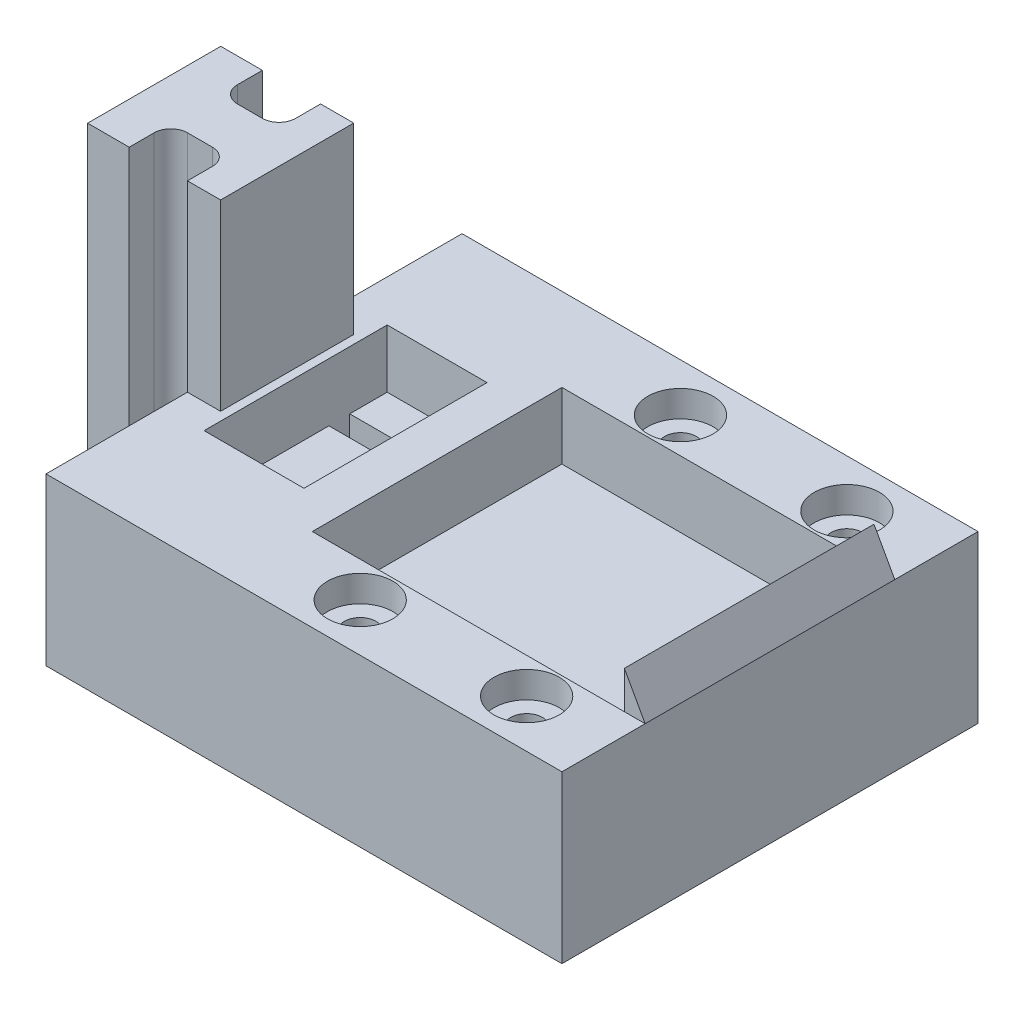
from build123d import *

# Parameters (mm, degrees)
SKETCH1_R               = 17.5
BOSS_EXTRUDE1_DEPTH     = 30
SKETCH5_R               = 10.95
CUT_EXTRUDE2_DEPTH      = 39.890873
SWEEP2_PITCH            = 10
SKETCH8_R               = 17.5
CUT_EXTRUDE3_DEPTH      = 41.699
SKETCH9_R               = 17.5
CUT_EXTRUDE4_DEPTH      = 39.890874
SKETCH10_W              = 40
SKETCH10_H              = 19.977262
BOSS_EXTRUDE2_DEPTH     = 40
SKETCH11_W              = 40
SKETCH11_H              = 19.977262
BOSS_EXTRUDE3_DEPTH     = 10
BOSS_EXTRUDE4_DEPTH     = 30
SKETCH14_R              = 1.905
CUT_EXTRUDE5_DEPTH      = 71.869594
SKETCH15_R              = 3.9243
CUT_EXTRUDE7_DEPTH      = 59.798031
SKETCH16_W              = 50
SKETCH16_H              = 19.977262
BOSS_EXTRUDE5_DEPTH     = 22
CUT_EXTRUDE8_DEPTH      = 12
BOSS_EXTRUDE6_DEPTH     = 19.977262
BOSS_EXTRUDE7_DEPTH     = 22
FILLET1_R               = 2
SKETCH21_W              = 7
SKETCH21_H              = 16
BOSS_EXTRUDE8_DEPTH     = 2
CUT_EXTRUDE9_DEPTH      = 76.769387
CUT_EXTRUDE9_DEPTH_BACK = 76.769387
SKETCH22_W              = 37.5
SKETCH22_H              = 30
SKETCH24_W              = 37.5
SKETCH24_H              = 30
BOSS_EXTRUDE9_DEPTH     = 12


with BuildPart() as part:
    # Sketch1 → Boss-Extrude1 (new body)
    with BuildSketch(Plane.XY):
        Circle(SKETCH1_R)
    extrude(amount=BOSS_EXTRUDE1_DEPTH)

    # Sketch5 → Cut-Extrude2 (cut, through all)
    with BuildSketch(Plane(origin=(0, 0, 0), x_dir=(-1, 0, 0), z_dir=(0, 0, -1))):
        Circle(SKETCH5_R)
    extrude(amount=-CUT_EXTRUDE2_DEPTH, mode=Mode.SUBTRACT)

    # Sweep2: arcs per turn and ends read off the stored shape
    # Sweep2: the profile of Sketch7 profile screwed along a right-hand helix through 3.75 turns, 16 arcs to a turn; built about Z, then put on its axis
    sweep2_z = Axis((0, 0, 0), (0, 0, 1))
    sweep2_corners = [(0, 7.7, 2.933013), (0, 10.9503, 4.809574), (0, 10.9503, 0.190426), (0, 7.7, 2.066987), (0, 7.45, 2.5)]
    with BuildLine(mode=Mode.PRIVATE) as sweep2_profile:
        Line(sweep2_corners[0], sweep2_corners[1])
        Line(sweep2_corners[1], sweep2_corners[2])
        Line(sweep2_corners[2], sweep2_corners[3])
        ThreePointArc((0, 7.7, 2.066987), (0, 7.516988, 2.25), (0, 7.45, 2.5))
        ThreePointArc((0, 7.45, 2.5), (0, 7.516988, 2.75), (0, 7.7, 2.933013))
    sweep2_cap = Face(sweep2_profile.wire())
    sweep2_arcs = [((0, 7.7, 2.066987), (0, 7.45, 2.211325), (0, 7.45, 2.5), (1, 0.8660254037844395, 1)), ((0, 7.45, 2.5), (0, 7.45, 2.788675), (0, 7.7, 2.933013), (1, 0.8660254037844395, 1))]  # start, shoulder, end, weights
    sweep2_turn_angles = [0, 11.25, 22.5, 33.75, 45, 56.25, 67.5, 78.75, 90, 101.25, 112.5, 123.75, 135, 146.25, 157.5, 168.75, 180, 191.25, 202.5, 213.75, 225, 236.25, 247.5, 258.75, 270, 281.25, 292.5, 303.75, 315, 326.25, 337.5, 348.75, 360]
    sweep2_turn_weights = [1, 0.9807852804032304, 1, 0.9807852804032304, 1, 0.9807852804032304, 1, 0.9807852804032304, 1, 0.9807852804032304, 1, 0.9807852804032304, 1, 0.9807852804032304, 1, 0.9807852804032304, 1, 0.9807852804032304, 1, 0.9807852804032304, 1, 0.9807852804032304, 1, 0.9807852804032304, 1, 0.9807852804032304, 1, 0.9807852804032304, 1, 0.9807852804032304, 1, 0.9807852804032304, 1]
    sweep2_turn_rails = [Edge.make_bspline([Vector(p[0], p[1], 0).rotate(sweep2_z, sweep2_turn_angles[k]) / sweep2_turn_weights[k] + Vector(0, 0, p[2] + SWEEP2_PITCH * sweep2_turn_angles[k] / 360) for k in range(33)], [0, 0, 0, 1, 1, 2, 2, 3, 3, 4, 4, 5, 5, 6, 6, 7, 7, 8, 8, 9, 9, 10, 10, 11, 11, 12, 12, 13, 13, 14, 14, 15, 15, 16, 16, 16], 2, sweep2_turn_weights) for p in sweep2_corners]
    sweep2_turn_sides = [*[Face.make_surface_from_curves(sweep2_turn_rails[p[0]], sweep2_turn_rails[p[1]]) for p in [(0, 1), (1, 2), (2, 3)]], *[Face.make_bezier_surface([[Vector(p[j][0], p[j][1], 0).rotate(sweep2_z, sweep2_turn_angles[2 * i + k]) / sweep2_turn_weights[2 * i + k] + Vector(0, 0, p[j][2] + SWEEP2_PITCH * sweep2_turn_angles[2 * i + k] / 360) for k in range(3)] for j in range(3)], [[p[3][j] * sweep2_turn_weights[2 * i + k] for k in range(3)] for j in range(3)]) for p in sweep2_arcs for i in range(16)]]
    sweep2_last_angles = [1080, 1091.25, 1102.5, 1113.75, 1125, 1136.25, 1147.5, 1158.75, 1170, 1181.25, 1192.5, 1203.75, 1215, 1226.25, 1237.5, 1248.75, 1260, 1271.25, 1282.5, 1293.75, 1305, 1316.25, 1327.5, 1338.75, 1350]
    sweep2_last_weights = [1, 0.9807852804032304, 1, 0.9807852804032304, 1, 0.9807852804032304, 1, 0.9807852804032304, 1, 0.9807852804032304, 1, 0.9807852804032304, 1, 0.9807852804032304, 1, 0.9807852804032304, 1, 0.9807852804032304, 1, 0.9807852804032304, 1, 0.9807852804032304, 1, 0.9807852804032304, 1]
    sweep2_last_rails = [Edge.make_bspline([Vector(p[0], p[1], 0).rotate(sweep2_z, sweep2_last_angles[k]) / sweep2_last_weights[k] + Vector(0, 0, p[2] + SWEEP2_PITCH * sweep2_last_angles[k] / 360) for k in range(25)], [0, 0, 0, 1, 1, 2, 2, 3, 3, 4, 4, 5, 5, 6, 6, 7, 7, 8, 8, 9, 9, 10, 10, 11, 11, 12, 12, 12], 2, sweep2_last_weights) for p in sweep2_corners]
    sweep2_last_sides = [*[Face.make_surface_from_curves(sweep2_last_rails[p[0]], sweep2_last_rails[p[1]]) for p in [(0, 1), (1, 2), (2, 3)]], *[Face.make_bezier_surface([[Vector(p[j][0], p[j][1], 0).rotate(sweep2_z, sweep2_last_angles[2 * i + k]) / sweep2_last_weights[2 * i + k] + Vector(0, 0, p[j][2] + SWEEP2_PITCH * sweep2_last_angles[2 * i + k] / 360) for k in range(3)] for j in range(3)], [[p[3][j] * sweep2_last_weights[2 * i + k] for k in range(3)] for j in range(3)]) for p in sweep2_arcs for i in range(12)]]
    sweep2 = Plane(origin=(0, 0, -10), x_dir=(-1, 0, 0), z_dir=(0, 0, 1)) * Solid(Shell([*[p.moved(Location((0, 0, SWEEP2_PITCH * i))) for i in range(3) for p in sweep2_turn_sides], *sweep2_last_sides, sweep2_cap, sweep2_cap.rotate(sweep2_z, 1350).moved(Location((0, 0, SWEEP2_PITCH * 1350 / 360)))]))
    add(sweep2)

    # Sketch8 → Cut-Extrude3 (cut, through all)
    with BuildSketch(Plane(origin=(0, 0, 0), x_dir=(-1, 0, 0), z_dir=(0, 0, -1))):
        with Locations(Location((0, 0, 0), (0, 0, 180))):
            Circle(SKETCH8_R)
    extrude(amount=CUT_EXTRUDE3_DEPTH, mode=Mode.SUBTRACT)

    # Sketch9 → Cut-Extrude4 (cut, through all)
    with BuildSketch(Plane.XY.offset(30)):
        Circle(SKETCH9_R)
    extrude(amount=CUT_EXTRUDE4_DEPTH, mode=Mode.SUBTRACT)



with BuildPart() as body_2:
    # Sketch10 → Boss-Extrude2 (new body)
    with BuildSketch(Plane(origin=(0, 0, 0), x_dir=(-1, 0, 0), z_dir=(0, 0, -1))):
        with Locations((0, -27.488631)):
            Rectangle(SKETCH10_W, SKETCH10_H)
    extrude(amount=-BOSS_EXTRUDE2_DEPTH)

    # Sketch11 → Boss-Extrude3 (add)
    with BuildSketch(Plane(origin=(0, 0, 0), x_dir=(-1, 0, 0), z_dir=(0, 0, -1))):
        with Locations((0, -27.488631)):
            Rectangle(SKETCH11_W, SKETCH11_H)
    extrude(amount=BOSS_EXTRUDE3_DEPTH)


with BuildPart() as part_1:
    add(part.part)

    add(body_2.part)  # Boss-Extrude4 merges body 2
    # Sketch13 → Boss-Extrude4 (add)
    with BuildSketch(Plane(origin=(0, 0, 0), x_dir=(-1, 0, 0), z_dir=(0, 0, -1))):
        with BuildLine():
            Line((0, -17.5), (-20, -17.5))
            Line((-20, -17.5), (-15.153881, -8.752707))
            ThreePointArc((-15.153881, -8.752707), (-8.748646, -15.156226), (0, -17.5))
        make_face()
    boss_extrude4 = extrude(amount=-BOSS_EXTRUDE4_DEPTH)

    # Mirror1: Boss-Extrude4 across plane
    add(boss_extrude4.mirror(Plane(origin=(0, 0, 0), x_dir=(0, 0, 1), z_dir=(1, 0, 0))))

    # Sketch14 → Cut-Extrude5 (cut, through all)
    with BuildSketch(Plane.XZ.offset(37.477262)):
        with Locations(Location((-10, 34.242642, 0), (0, 0, 270))):
            Circle(SKETCH14_R)
        with Locations(Location((10, 34.242642, 0), (0, 0, 270))):
            Circle(SKETCH14_R)
        with Locations(Location((-10, -4.242642, 0), (0, 0, 270))):
            Circle(SKETCH14_R)
        with Locations(Location((10, -4.242642, 0), (0, 0, 270))):
            Circle(SKETCH14_R)
    extrude(amount=-CUT_EXTRUDE5_DEPTH, mode=Mode.SUBTRACT)

    # Sketch15 → Cut-Extrude7 (cut, through all)
    with BuildSketch(Plane(origin=(0, -20.6734, 0), x_dir=(1, 0, 0), z_dir=(0, 1, 0))):
        with Locations(Location((-10, 4.242642, 0), (0, 0, 270))):
            Circle(SKETCH15_R)
        with Locations(Location((10, 4.242642, 0), (0, 0, 270))):
            Circle(SKETCH15_R)
        with Locations(Location((10, -34.242642, 0), (0, 0, 270))):
            Circle(SKETCH15_R)
        with Locations(Location((-10, -34.242642, 0), (0, 0, 270))):
            Circle(SKETCH15_R)
    extrude(amount=CUT_EXTRUDE7_DEPTH, mode=Mode.SUBTRACT)

    # Sketch16 → Boss-Extrude5 (add)
    with BuildSketch(Plane.ZY.offset(20)):
        with Locations((15, -27.488631)):
            Rectangle(SKETCH16_W, SKETCH16_H)
    extrude(amount=BOSS_EXTRUDE5_DEPTH)

    # Sketch17 → Cut-Extrude8 (cut)
    with BuildSketch(Plane.ZY.offset(37)):
        Polygon((4, -24.5), (8.5, -24.5), (8.5, -29.488888), (11, -29.488888), (11, -24.5), (26, -24.5), (26, -17.5), (4, -17.5), align=None)
    extrude(amount=-CUT_EXTRUDE8_DEPTH, mode=Mode.SUBTRACT)

    # Sketch19 → Boss-Extrude6 (add, through all)
    with BuildSketch(Plane(origin=(0, -17.5, 0), x_dir=(1, 0, 0), z_dir=(0, 1, 0))):
        Polygon((-42, -12), (-49, -12), (-49, -7), (-54, -7), (-54, -23), (-49, -23), (-49, -18), (-42, -18), align=None)
    extrude(amount=-BOSS_EXTRUDE6_DEPTH)

    # Sketch20 → Boss-Extrude7 (add)
    with BuildSketch(Plane(origin=(0, -17.5, 0), x_dir=(1, 0, 0), z_dir=(0, 1, 0))):
        Polygon((-54, -7), (-49, -7), (-49, -12), (-42, -12), (-42, -7), (-38.018198, -7), (-38.018198, -23), (-42, -23), (-42, -18), (-49, -18), (-49, -23), (-54, -23), align=None)
    extrude(amount=BOSS_EXTRUDE7_DEPTH)

    # Fillet1
    fillet1_edges = [part_1.edges().sort_by_distance(p)[0] for p in [
        (-42, -16.488631, 12),
        (-42, -16.488631, 18),
        (-49, -16.488631, 18),
        (-49, -16.488631, 12),
    ]]
    fillet(fillet1_edges, radius=FILLET1_R)

    # Sketch21 → Boss-Extrude8 (add)
    with BuildSketch(Plane.XZ.offset(37.477262)):
        with Locations((-45.5, 15)):
            Rectangle(SKETCH21_W, SKETCH21_H)
    extrude(amount=-BOSS_EXTRUDE8_DEPTH)

    # Sketch22 → Cut-Extrude9 (cut, two sides: drawn at the far end of the back side and taken through both)
    with BuildSketch(Plane(origin=(0, -17.5, 0), x_dir=(1, 0, 0), z_dir=(0, 1, 0)).offset(-CUT_EXTRUDE9_DEPTH_BACK)):
        with Locations((-1.25, -15)):
            Rectangle(SKETCH22_W, SKETCH22_H)
    extrude(amount=CUT_EXTRUDE9_DEPTH + CUT_EXTRUDE9_DEPTH_BACK, mode=Mode.SUBTRACT)

    # Sketch24 → Boss-Extrude9 (add)
    with BuildSketch(Plane.XZ.offset(37.477262)):
        with Locations((-1.25, 15)):
            Rectangle(SKETCH24_W, SKETCH24_H)
    extrude(amount=-BOSS_EXTRUDE9_DEPTH)


solid = part_1.part
